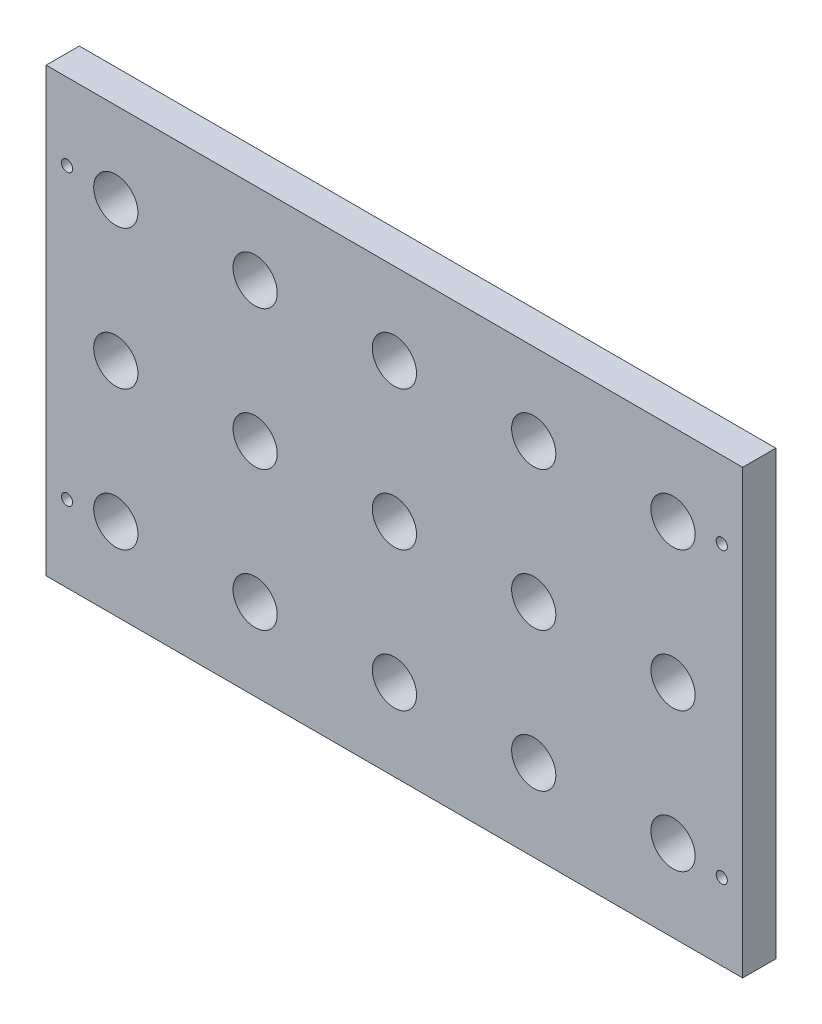
from build123d import *

# Parameters (mm, degrees)
SKETCH1_W          = 200
SKETCH1_H          = 127
SKETCH1_R          = 1.6
WALL_DEPTH         = 9.525
CANNULAHOLES_REACH = 239.107
SKETCH4_R          = 6.35


with BuildPart() as part:
    # Sketch1 → Wall (new body)
    with BuildSketch(Plane.XY):
        with Locations((100, 63.5)):
            Rectangle(SKETCH1_W, SKETCH1_H)
        with Locations((6, 105)):
            Circle(SKETCH1_R, mode=Mode.SUBTRACT)
        with Locations((6, 22)):
            Circle(SKETCH1_R, mode=Mode.SUBTRACT)
        with Locations((194, 22)):
            Circle(SKETCH1_R, mode=Mode.SUBTRACT)
        with Locations((194, 105)):
            Circle(SKETCH1_R, mode=Mode.SUBTRACT)
    extrude(amount=WALL_DEPTH)

    # Sketch4 → CannulaHoles (cut, up to next)
    with BuildSketch(Plane.XY.offset(9.525), mode=Mode.PRIVATE) as cannulaholes_sk1:
        with Locations((60, 103.5)):
            Circle(SKETCH4_R)
    cannulaholes_tool1 = extrude(cannulaholes_sk1.sketch, amount=-CANNULAHOLES_REACH, mode=Mode.PRIVATE) & part.part
    # Sketch4 → CannulaHoles (cut, up to next)
    with BuildSketch(Plane.XY.offset(9.525), mode=Mode.PRIVATE) as cannulaholes_sk2:
        with Locations((20, 103.5)):
            Circle(SKETCH4_R)
    cannulaholes_tool2 = extrude(cannulaholes_sk2.sketch, amount=-CANNULAHOLES_REACH, mode=Mode.PRIVATE) & part.part
    # Sketch4 → CannulaHoles (cut, up to next)
    with BuildSketch(Plane.XY.offset(9.525), mode=Mode.PRIVATE) as cannulaholes_sk3:
        with Locations((100, 103.5)):
            Circle(SKETCH4_R)
    cannulaholes_tool3 = extrude(cannulaholes_sk3.sketch, amount=-CANNULAHOLES_REACH, mode=Mode.PRIVATE) & part.part
    # Sketch4 → CannulaHoles (cut, up to next)
    with BuildSketch(Plane.XY.offset(9.525), mode=Mode.PRIVATE) as cannulaholes_sk4:
        with Locations((140, 103.5)):
            Circle(SKETCH4_R)
    cannulaholes_tool4 = extrude(cannulaholes_sk4.sketch, amount=-CANNULAHOLES_REACH, mode=Mode.PRIVATE) & part.part
    # Sketch4 → CannulaHoles (cut, up to next)
    with BuildSketch(Plane.XY.offset(9.525), mode=Mode.PRIVATE) as cannulaholes_sk5:
        with Locations((60, 63.5)):
            Circle(SKETCH4_R)
    cannulaholes_tool5 = extrude(cannulaholes_sk5.sketch, amount=-CANNULAHOLES_REACH, mode=Mode.PRIVATE) & part.part
    # Sketch4 → CannulaHoles (cut, up to next)
    with BuildSketch(Plane.XY.offset(9.525), mode=Mode.PRIVATE) as cannulaholes_sk6:
        with Locations((100, 63.5)):
            Circle(SKETCH4_R)
    cannulaholes_tool6 = extrude(cannulaholes_sk6.sketch, amount=-CANNULAHOLES_REACH, mode=Mode.PRIVATE) & part.part
    # Sketch4 → CannulaHoles (cut, up to next)
    with BuildSketch(Plane.XY.offset(9.525), mode=Mode.PRIVATE) as cannulaholes_sk7:
        with Locations((140, 63.5)):
            Circle(SKETCH4_R)
    cannulaholes_tool7 = extrude(cannulaholes_sk7.sketch, amount=-CANNULAHOLES_REACH, mode=Mode.PRIVATE) & part.part
    # Sketch4 → CannulaHoles (cut, up to next)
    with BuildSketch(Plane.XY.offset(9.525), mode=Mode.PRIVATE) as cannulaholes_sk8:
        with Locations((60, 23.5)):
            Circle(SKETCH4_R)
    cannulaholes_tool8 = extrude(cannulaholes_sk8.sketch, amount=-CANNULAHOLES_REACH, mode=Mode.PRIVATE) & part.part
    # Sketch4 → CannulaHoles (cut, up to next)
    with BuildSketch(Plane.XY.offset(9.525), mode=Mode.PRIVATE) as cannulaholes_sk9:
        with Locations((100, 23.5)):
            Circle(SKETCH4_R)
    cannulaholes_tool9 = extrude(cannulaholes_sk9.sketch, amount=-CANNULAHOLES_REACH, mode=Mode.PRIVATE) & part.part
    # Sketch4 → CannulaHoles (cut, up to next)
    with BuildSketch(Plane.XY.offset(9.525), mode=Mode.PRIVATE) as cannulaholes_sk10:
        with Locations((140, 23.5)):
            Circle(SKETCH4_R)
    cannulaholes_tool10 = extrude(cannulaholes_sk10.sketch, amount=-CANNULAHOLES_REACH, mode=Mode.PRIVATE) & part.part
    # Sketch4 → CannulaHoles (cut, up to next)
    with BuildSketch(Plane.XY.offset(9.525), mode=Mode.PRIVATE) as cannulaholes_sk11:
        with Locations((20, 63.5)):
            Circle(SKETCH4_R)
    cannulaholes_tool11 = extrude(cannulaholes_sk11.sketch, amount=-CANNULAHOLES_REACH, mode=Mode.PRIVATE) & part.part
    # Sketch4 → CannulaHoles (cut, up to next)
    with BuildSketch(Plane.XY.offset(9.525), mode=Mode.PRIVATE) as cannulaholes_sk12:
        with Locations((20, 23.5)):
            Circle(SKETCH4_R)
    cannulaholes_tool12 = extrude(cannulaholes_sk12.sketch, amount=-CANNULAHOLES_REACH, mode=Mode.PRIVATE) & part.part
    # Sketch4 → CannulaHoles (cut, up to next)
    with BuildSketch(Plane.XY.offset(9.525), mode=Mode.PRIVATE) as cannulaholes_sk13:
        with Locations((180, 103.5)):
            Circle(SKETCH4_R)
    cannulaholes_tool13 = extrude(cannulaholes_sk13.sketch, amount=-CANNULAHOLES_REACH, mode=Mode.PRIVATE) & part.part
    # Sketch4 → CannulaHoles (cut, up to next)
    with BuildSketch(Plane.XY.offset(9.525), mode=Mode.PRIVATE) as cannulaholes_sk14:
        with Locations((180, 63.5)):
            Circle(SKETCH4_R)
    cannulaholes_tool14 = extrude(cannulaholes_sk14.sketch, amount=-CANNULAHOLES_REACH, mode=Mode.PRIVATE) & part.part
    # Sketch4 → CannulaHoles (cut, up to next)
    with BuildSketch(Plane.XY.offset(9.525), mode=Mode.PRIVATE) as cannulaholes_sk15:
        with Locations((180, 23.5)):
            Circle(SKETCH4_R)
    cannulaholes_tool15 = extrude(cannulaholes_sk15.sketch, amount=-CANNULAHOLES_REACH, mode=Mode.PRIVATE) & part.part
    add(cannulaholes_tool1.solids().sort_by_distance((60, 103.5, 9.525))[0], mode=Mode.SUBTRACT)
    add(cannulaholes_tool2.solids().sort_by_distance((20, 103.5, 9.525))[0], mode=Mode.SUBTRACT)
    add(cannulaholes_tool3.solids().sort_by_distance((100, 103.5, 9.525))[0], mode=Mode.SUBTRACT)
    add(cannulaholes_tool4.solids().sort_by_distance((140, 103.5, 9.525))[0], mode=Mode.SUBTRACT)
    add(cannulaholes_tool5.solids().sort_by_distance((60, 63.5, 9.525))[0], mode=Mode.SUBTRACT)
    add(cannulaholes_tool6.solids().sort_by_distance((100, 63.5, 9.525))[0], mode=Mode.SUBTRACT)
    add(cannulaholes_tool7.solids().sort_by_distance((140, 63.5, 9.525))[0], mode=Mode.SUBTRACT)
    add(cannulaholes_tool8.solids().sort_by_distance((60, 23.5, 9.525))[0], mode=Mode.SUBTRACT)
    add(cannulaholes_tool9.solids().sort_by_distance((100, 23.5, 9.525))[0], mode=Mode.SUBTRACT)
    add(cannulaholes_tool10.solids().sort_by_distance((140, 23.5, 9.525))[0], mode=Mode.SUBTRACT)
    add(cannulaholes_tool11.solids().sort_by_distance((20, 63.5, 9.525))[0], mode=Mode.SUBTRACT)
    add(cannulaholes_tool12.solids().sort_by_distance((20, 23.5, 9.525))[0], mode=Mode.SUBTRACT)
    add(cannulaholes_tool13.solids().sort_by_distance((180, 103.5, 9.525))[0], mode=Mode.SUBTRACT)
    add(cannulaholes_tool14.solids().sort_by_distance((180, 63.5, 9.525))[0], mode=Mode.SUBTRACT)
    add(cannulaholes_tool15.solids().sort_by_distance((180, 23.5, 9.525))[0], mode=Mode.SUBTRACT)


solid = part.part
